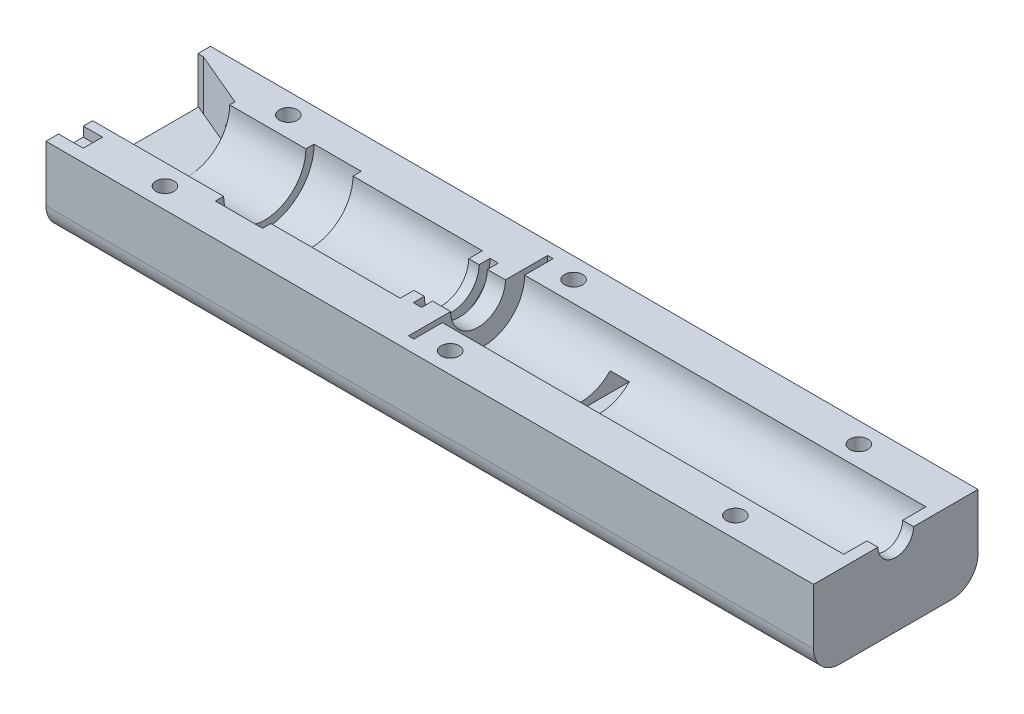
from build123d import *

# Parameters (mm, degrees)
SKETCH2_W                 = 140
SKETCH2_H                 = 15
BASE_DEPTH                = 15
SKETCH3_R                 = 7.5
CENTER_CUT_DEPTH          = 142.598022585
SKETCH4_W                 = 1
SKETCH4_H                 = 25.4
ANTENNA_PCB_DEPTH         = 10.2
SKETCH14_W                = 3.5
SKETCH14_H                = 3.5
COAXIAL_CONNECTOR_DEPTH   = 3.5
LENS_START                = -23.9
SKETCH8_R                 = 9
LENS_DEPTH                = 8.6
PHOTODIODE_PCB_START      = -62.8
SKETCH10_W                = 25.4
SKETCH10_H                = 20.4
PHOTODIODE_PCB_DEPTH      = 1
FILLET1_R                 = 4.8
COAX_CONNECTOR_HOLE_START = -2
COAX_CONNECTOR_HOLE_DEPTH = 2
SKETCH16_W                = 12.7
SKETCH16_H                = 7.5
CUT_EXTRUDE2_DEPTH        = 10
BOSS_EXTRUDE1_REACH       = 143.598
CUT_EXTRUDE3_DEPTH        = 2.7
SKETCH19_R                = 1.65
CUT_EXTRUDE4_DEPTH        = 15
SKETCH20_R                = 2.85
CUT_EXTRUDE5_DEPTH        = 1.5
CUT_EXTRUDE6_REACH        = 145.962
SKETCH21_W                = 3
SKETCH21_H                = 4.5
SKETCH22_W                = 75
SKETCH22_H                = 3.5
CUT_EXTRUDE7_DEPTH        = 2
SKETCH24_W                = 3.5
SKETCH24_H                = 3.5
CUT_EXTRUDE8_DEPTH        = 15
CHAMFER2_SIZE             = 1.5
FILTER_MOUNT_START        = -56.1
FILTER_MOUNT_DEPTH        = 6.7
FILTER_SPACE_START        = -58
SKETCH9_R                 = 7
FILTER_SPACE_DEPTH        = 1.5


with BuildPart() as part:
    # Sketch2 → Base (new body)
    with BuildSketch(Plane(origin=(0, 0, 0), x_dir=(1, 0, 0), z_dir=(0, 1, 0))):
        with Locations((70, -7.5)):
            Rectangle(SKETCH2_W, SKETCH2_H)
        with Locations((70, 7.5)):
            Rectangle(SKETCH2_W, SKETCH2_H)
    extrude(amount=-BASE_DEPTH)

    # Sketch3 → Center_cut (cut, through all)
    with BuildSketch(Plane.ZY):
        Circle(SKETCH3_R)
    extrude(amount=-CENTER_CUT_DEPTH, mode=Mode.SUBTRACT)

    # Sketch4 → Antenna_PCB (cut)
    with BuildSketch(Plane(origin=(0, 0, 0), x_dir=(1, 0, 0), z_dir=(0, 1, 0))):
        with Locations((0.5, 0)):
            Rectangle(SKETCH4_W, SKETCH4_H)
    extrude(amount=-ANTENNA_PCB_DEPTH, mode=Mode.SUBTRACT)

    # Sketch14 → Coaxial_connector (cut)
    with BuildSketch(Plane.ZY.offset(-1)):
        with Locations((10.95, 0)):
            Rectangle(SKETCH14_W, SKETCH14_H)
    extrude(amount=-COAXIAL_CONNECTOR_DEPTH, mode=Mode.SUBTRACT)

    # Sketch8 → Lens (cut)
    with BuildSketch(Plane.ZY.offset(-1).offset(LENS_START)):
        Circle(SKETCH8_R)
    extrude(amount=-LENS_DEPTH, mode=Mode.SUBTRACT)

    # Sketch10 → Photodiode_PCB (cut)
    with BuildSketch(Plane.ZY.offset(-1).offset(PHOTODIODE_PCB_START)):
        Rectangle(SKETCH10_W, SKETCH10_H)
    extrude(amount=-PHOTODIODE_PCB_DEPTH, mode=Mode.SUBTRACT)

    # Fillet1
    fillet1_edges = [part.edges().sort_by_distance(p)[0] for p in [
        (70, -15, -15),
        (70, -15, 15),
    ]]
    fillet(fillet1_edges, radius=FILLET1_R)

    # Sketch15 → Coax_connector_hole (add)
    with BuildSketch(Plane(origin=(140, 0, 0), x_dir=(0, 0, -1), z_dir=(1, 0, 0)).offset(COAX_CONNECTOR_HOLE_START)):
        with BuildLine():
            ThreePointArc((-7.5, 0), (0, -7.5), (7.5, 0))
            Line((7.5, 0), (3.25, 0))
            ThreePointArc((3.25, 0), (0, -3.25), (-3.25, 0))
            Line((-3.25, 0), (-7.5, 0))
        make_face()
        with BuildLine():
            Line((11.25, -8), (11.25, 0))
            Line((11.25, 0), (7.5, 0))
            ThreePointArc((7.5, 0), (0, -7.5), (-7.5, 0))
            Line((-7.5, 0), (-11.25, 0))
            Line((-11.25, 0), (-11.25, -8))
            Line((-11.25, -8), (11.25, -8))
        make_face()
    extrude(amount=COAX_CONNECTOR_HOLE_DEPTH)

    # Sketch16 → Cut-Extrude2 (cut)
    with BuildSketch(Plane.ZY.offset(-1)):
        with Locations((-6.35, -3.75)):
            Rectangle(SKETCH16_W, SKETCH16_H)
    extrude(amount=-CUT_EXTRUDE2_DEPTH, mode=Mode.SUBTRACT)

    # Sketch17 → Boss-Extrude1 (add, up to next)
    with BuildSketch(Plane(origin=(0, 0, 0), x_dir=(1, 0, 0), z_dir=(0, 1, 0)), mode=Mode.PRIVATE) as boss_extrude1_sk1:
        Polygon((1, 12.7), (11, 8.455251838), (11, 12.7), align=None)
    boss_extrude1_tool1 = extrude(boss_extrude1_sk1.sketch, amount=-BOSS_EXTRUDE1_REACH, mode=Mode.PRIVATE) - part.part
    add(boss_extrude1_tool1.solids().sort_by_distance((7.666667, 0, -11.285084))[0])

    # Sketch18 → Cut-Extrude3 (cut)
    with BuildSketch(Plane(origin=(0, -7.5, 0), x_dir=(1, 0, 0), z_dir=(0, 1, 0))):
        Polygon((11, 8.455251838), (1, 12.7), (1, 11.830911698), (11, 7.586163536), align=None)
    extrude(amount=-CUT_EXTRUDE3_DEPTH, mode=Mode.SUBTRACT)

    # Sketch19 → Cut-Extrude4 (cut)
    with BuildSketch(Plane(origin=(0, 0, 0), x_dir=(1, 0, 0), z_dir=(0, 1, 0))):
        with Locations(Location((17.95, 11.25, 0), (0, 0, 270))):
            Circle(SKETCH19_R)
        with Locations(Location((122, 11.25, 0), (0, 0, 270))):
            Circle(SKETCH19_R)
        with Locations(Location((122, -11.25, 0), (0, 0, 39.521196359))):
            Circle(SKETCH19_R)
        with Locations(Location((17.95, -11.25, 0), (0, 0, 140.478803641))):
            Circle(SKETCH19_R)
        with Locations(Location((69.975, 11.25, 0), (0, 0, 270))):
            Circle(SKETCH19_R)
        with Locations(Location((69.975, -11.25, 0), (0, 0, 39.521196359))):
            Circle(SKETCH19_R)
    extrude(amount=-CUT_EXTRUDE4_DEPTH, mode=Mode.SUBTRACT)

    # Sketch20 → Cut-Extrude5 (cut)
    with BuildSketch(Plane.XZ.offset(15)):
        with Locations((17.95, 11.25)):
            Circle(SKETCH20_R)
        with Locations((122.05, 11.25)):
            Circle(SKETCH20_R)
        with Locations((122.05, -11.25)):
            Circle(SKETCH20_R)
        with Locations((17.95, -11.25)):
            Circle(SKETCH20_R)
        with Locations((69.975, 11.25)):
            Circle(SKETCH20_R)
        with Locations((69.975, -11.25)):
            Circle(SKETCH20_R)
    extrude(amount=-CUT_EXTRUDE5_DEPTH, mode=Mode.SUBTRACT)

    # Cut-Extrude6: up to this plane
    cut_extrude6_end = Plane(origin=(1, -15.002, -12.7), z_dir=(-0.3907311284892679, 0, 0.9205048534524428))
    # Sketch21 → Cut-Extrude6 (cut, up to the surface)
    with BuildSketch(Plane(origin=(0, 0, -15), x_dir=(-1, 0, 0), z_dir=(0, 0, -1)), mode=Mode.PRIVATE) as cut_extrude6_sk1:
        with Locations((-9.5, -7.95)):
            Rectangle(SKETCH21_W, SKETCH21_H)
    cut_extrude6_tool1 = split(extrude(cut_extrude6_sk1.sketch, amount=-CUT_EXTRUDE6_REACH, mode=Mode.PRIVATE), bisect_by=cut_extrude6_end, keep=Keep.BOTH, mode=Mode.PRIVATE)
    add(cut_extrude6_tool1.solids().sort_by_distance((9.5, -7.95, -15))[0], mode=Mode.SUBTRACT)

    # Sketch22 → Cut-Extrude7 (cut)
    with BuildSketch(Plane(origin=(0, 0, -15), x_dir=(-1, 0, 0), z_dir=(0, 0, -1))):
        with Locations((-48.5, -8.45)):
            Rectangle(SKETCH22_W, SKETCH22_H)
    extrude(amount=-CUT_EXTRUDE7_DEPTH, mode=Mode.SUBTRACT)

    # Sketch24 → Cut-Extrude8 (cut)
    with BuildSketch(Plane(origin=(0, 0, -15), x_dir=(-1, 0, 0), z_dir=(0, 0, -1))):
        with Locations((-84.25, -6.95)):
            Rectangle(SKETCH24_W, SKETCH24_H)
    extrude(amount=-CUT_EXTRUDE8_DEPTH, mode=Mode.SUBTRACT)

    # Chamfer2
    chamfer2_edges = [part.edges().sort_by_distance(p)[0] for p in [
        (84.25, -8.7, -13),
    ]]
    chamfer(chamfer2_edges, length=CHAMFER2_SIZE - 0.0001)  # a hair under: the kernel refuses the full size

    # Sketch25 → Filter_mount (add)
    with BuildSketch(Plane.ZY.offset(-1).offset(FILTER_MOUNT_START)):
        with BuildLine():
            ThreePointArc((0, -7.5), (5.303300859, -5.303300859), (7.5, 0))
            Line((7.5, 0), (5, 0))
            ThreePointArc((5, 0), (0, -5), (-5, 0))
            Line((-5, 0), (-7.5, 0))
            Line((-7.5, 0), (-7.5, -7.5))
            Line((-7.5, -7.5), (0, -7.5))
        make_face()
        with BuildLine():
            Line((7.5, -7.5), (7.5, 0))
            ThreePointArc((7.5, 0), (5.303300859, -5.303300859), (0, -7.5))
            Line((0, -7.5), (7.5, -7.5))
        make_face()
    extrude(amount=-FILTER_MOUNT_DEPTH)

    # Sketch9 → Filter_space (cut)
    with BuildSketch(Plane.ZY.offset(-1).offset(FILTER_SPACE_START)):
        Circle(SKETCH9_R)
    extrude(amount=-FILTER_SPACE_DEPTH, mode=Mode.SUBTRACT)


solid = part.part
